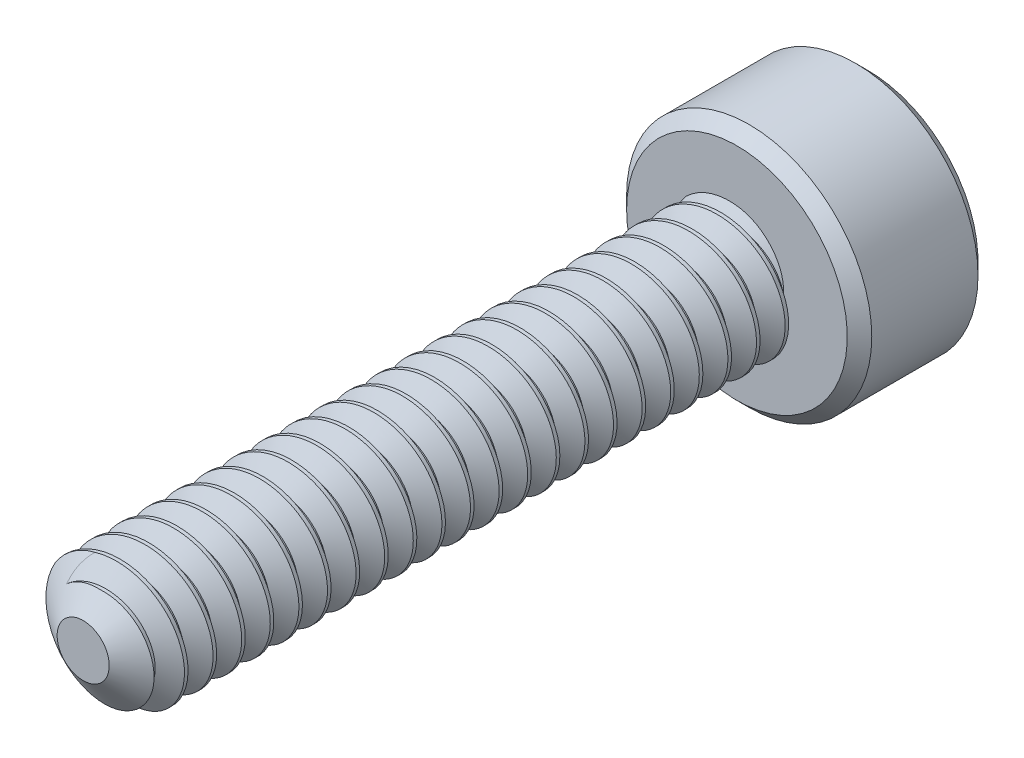
from build123d import *

# Parameters (mm, degrees)
SKETCH1_R          = 0.8
EXTRUDE1_DEPTH     = 8
CUT_SWEEP1_PITCH   = 0.35
SKETCH6_R          = 1.5
EXTRUDE2_DEPTH     = 1.6
CUT_EXTRUDE1_DEPTH = 1.125
CHAMFER1_SIZE      = 0.15


with BuildPart() as part:
    # Sketch1 → Extrude1 (new body)
    with BuildSketch(Plane.XY):
        Circle(SKETCH1_R)
    extrude(amount=-EXTRUDE1_DEPTH)

    # Cut-Sweep1: the profile of Sketch3 profile screwed along a right-hand helix of 23.857143 turns, 6 arcs to a turn; built about Z, then put on its axis
    cut_sweep1_z = Axis((0, 0, 0), (0, 0, 1))
    cut_sweep1_corners = [(0.8003, 0, -0.306423205), (0.572668332, 0, -0.175), (0.572668332, 0, -0.13125), (0.8003, 0, 0.000173205)]
    with BuildLine(mode=Mode.PRIVATE) as cut_sweep1_profile:
        Line(cut_sweep1_corners[0], cut_sweep1_corners[1])
        Line(cut_sweep1_corners[1], cut_sweep1_corners[2])
        Line(cut_sweep1_corners[2], cut_sweep1_corners[3])
        Line(cut_sweep1_corners[3], cut_sweep1_corners[0])
    cut_sweep1_cap = Face(cut_sweep1_profile.wire())
    cut_sweep1_turn_angles = [0, 30, 60, 90, 120, 150, 180, 210, 240, 270, 300, 330, 360]
    cut_sweep1_turn_weights = [1, 0.8660254037844387, 1, 0.8660254037844387, 1, 0.8660254037844387, 1, 0.8660254037844387, 1, 0.8660254037844387, 1, 0.8660254037844387, 1]
    cut_sweep1_turn_rails = [Edge.make_bspline([Vector(p[0], p[1], 0).rotate(cut_sweep1_z, cut_sweep1_turn_angles[k]) / cut_sweep1_turn_weights[k] + Vector(0, 0, p[2] + CUT_SWEEP1_PITCH * cut_sweep1_turn_angles[k] / 360) for k in range(13)], [0, 0, 0, 1, 1, 2, 2, 3, 3, 4, 4, 5, 5, 6, 6, 6], 2, cut_sweep1_turn_weights) for p in cut_sweep1_corners]
    cut_sweep1_turn_sides = [Face.make_surface_from_curves(cut_sweep1_turn_rails[p[0]], cut_sweep1_turn_rails[p[1]]) for p in [(0, 1), (1, 2), (2, 3), (3, 0)]]
    cut_sweep1_last_angles = [8280, 8310, 8340, 8370, 8400, 8430, 8460, 8490, 8520, 8550, 8580, 8584.285714286, 8588.571428571]
    cut_sweep1_last_weights = [1, 0.8660254037844387, 1, 0.8660254037844387, 1, 0.8660254037844387, 1, 0.8660254037844387, 1, 0.8660254037844387, 1, 0.9972037971811915, 1]
    cut_sweep1_last_rails = [Edge.make_bspline([Vector(p[0], p[1], 0).rotate(cut_sweep1_z, cut_sweep1_last_angles[k]) / cut_sweep1_last_weights[k] + Vector(0, 0, p[2] + CUT_SWEEP1_PITCH * cut_sweep1_last_angles[k] / 360) for k in range(13)], [0, 0, 0, 1, 1, 2, 2, 3, 3, 4, 4, 5, 5, 6, 6, 6], 2, cut_sweep1_last_weights) for p in cut_sweep1_corners]
    cut_sweep1_last_sides = [Face.make_surface_from_curves(cut_sweep1_last_rails[p[0]], cut_sweep1_last_rails[p[1]]) for p in [(0, 1), (1, 2), (2, 3), (3, 0)]]
    cut_sweep1 = Plane(origin=(0, 0, 0), x_dir=(0, 1, 0), z_dir=(0, 0, -1)) * Solid(Shell([*[p.moved(Location((0, 0, CUT_SWEEP1_PITCH * i))) for i in range(23) for p in cut_sweep1_turn_sides], *cut_sweep1_last_sides, cut_sweep1_cap, cut_sweep1_cap.rotate(cut_sweep1_z, 8588.571428571).moved(Location((0, 0, CUT_SWEEP1_PITCH * 8588.571428571 / 360)))]))
    add(cut_sweep1, mode=Mode.SUBTRACT)

    # Sketch4 → Cut-Revolve1 (revolve, cut)
    with BuildSketch(Plane(origin=(0, 0, 0), x_dir=(0, 0, -1), z_dir=(1, 0, 0)), mode=Mode.PRIVATE) as cut_revolve1_sk:
        Polygon((0.337032063, 0.8), (0, 0.318668332), (0, 0.8), align=None)
    revolve(cut_revolve1_sk.sketch.rotate(Axis((0, 0, 0), (0, 0, -1)), 301.815814274), axis=Axis((0, 0, 0), (0, 0, -1)), mode=Mode.SUBTRACT)

    # Sketch6 → Extrude2 (add)
    with BuildSketch(Plane(origin=(0, 0, -8), x_dir=(-1, 0, 0), z_dir=(0, 0, -1))):
        Circle(SKETCH6_R)
    extrude(amount=EXTRUDE2_DEPTH)

    # Sketch7 → Cut-Extrude1 (cut)
    with BuildSketch(Plane(origin=(0, 0, -9.6), x_dir=(-1, 0, 0), z_dir=(0, 0, -1))):
        Polygon((0, 0.866025404), (-0.75, 0.433012702), (-0.75, -0.433012702), (0, -0.866025404), (0.75, -0.433012702), (0.75, 0.433012702), align=None)
    extrude(amount=-CUT_EXTRUDE1_DEPTH, mode=Mode.SUBTRACT)

    # Cut-Extrude2 cone 1 section (through the dimple's axis) → Cut-Extrude2 (revolve, cut)
    with BuildSketch(Plane(origin=(0, 0, -9.6), x_dir=(0, 1, 0), z_dir=(1, 0, 0))):
        Polygon((0, 0), (0.866025404, 0), (0, 0.866025404), align=None)
    revolve(axis=Axis((0, 0, -9.6), (0, 0, 1)), mode=Mode.SUBTRACT)

    # Chamfer1
    chamfer1_edges = [part.edges().sort_by_distance(p)[0] for p in [
        (1.5, 0, -8),
        (1.5, 0, -9.6),
    ]]
    chamfer(chamfer1_edges, length=CHAMFER1_SIZE)


solid = part.part
